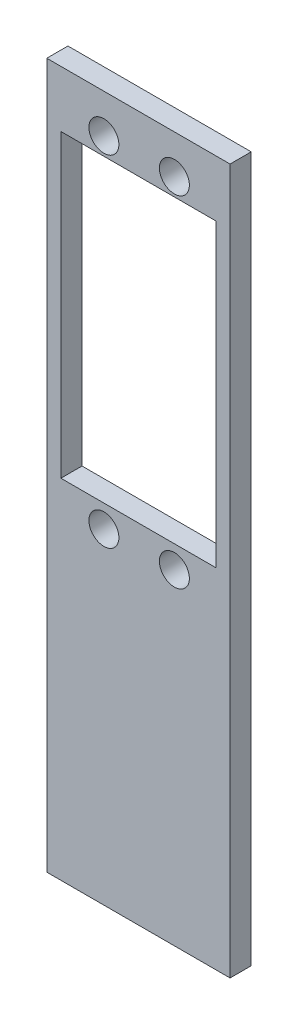
from build123d import *

# Parameters (mm, degrees)
SKETCH1_W           = 26
SKETCH1_H           = 100
BOSS_EXTRUDE1_DEPTH = 3
SKETCH2_W           = 22
SKETCH2_H           = 42.6
CUT_EXTRUDE1_DEPTH  = 3
HOLE1_D             = 4.25


with BuildPart() as part:
    # Sketch1 → Boss-Extrude1 (new body)
    with BuildSketch(Plane(origin=(0, 0, 7.302957559), x_dir=(-1, 0, 0), z_dir=(0, 0, -1))):
        with Locations((14.325270249, 28.74932998)):
            Rectangle(SKETCH1_W, SKETCH1_H)
    extrude(amount=BOSS_EXTRUDE1_DEPTH)

    # Sketch2 → Cut-Extrude1 (cut)
    with BuildSketch(Plane(origin=(0, 0, 4.302957559), x_dir=(-1, 0, 0), z_dir=(0, 0, -1))):
        with Locations((14.325270249, 49.44932998)):
            Rectangle(SKETCH2_W, SKETCH2_H)
    extrude(amount=-CUT_EXTRUDE1_DEPTH, mode=Mode.SUBTRACT)

    # Hole1 (through all)
    with Locations(Plane.XY.offset(7.302957559)):
        with Locations((-19.225270249, 73.24932998), (-9.225270249, 73.24932998), (-19.225270249, 24.94932998), (-9.225270249, 24.94932998)):
            Hole(HOLE1_D / 2)


solid = part.part
